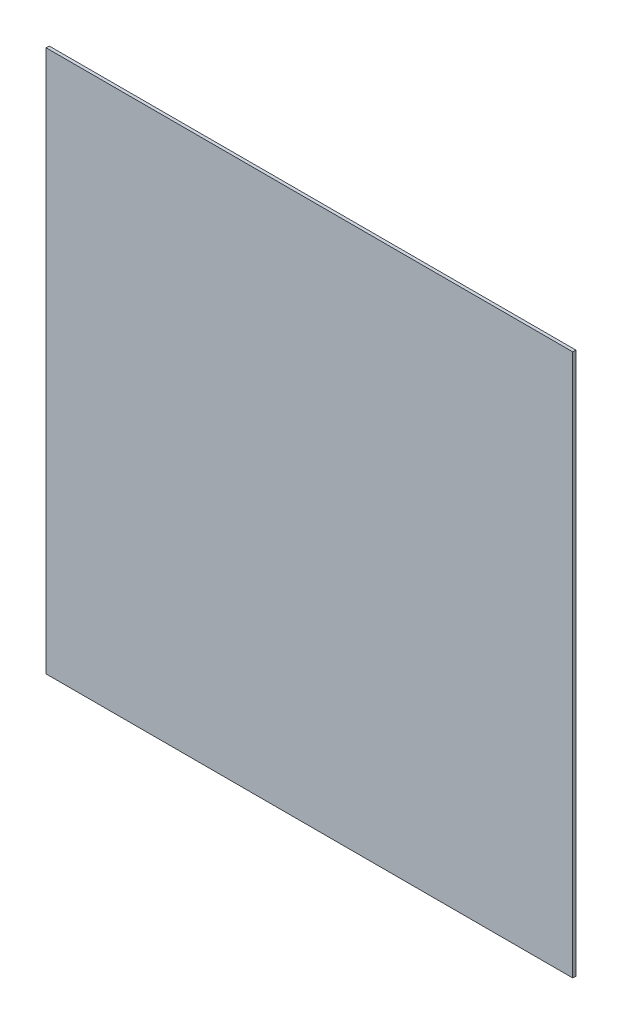
from build123d import *

# Parameters (mm, degrees)
SKICA1_W                = 505
SKICA1_H                = 520
P_IDAT_VYSUNUT_M1_DEPTH = 3


with BuildPart() as part:
    # Skica1 → Přidat vysunutím1 (new body)
    with BuildSketch(Plane.XY):
        Rectangle(SKICA1_W, SKICA1_H)
    extrude(amount=P_IDAT_VYSUNUT_M1_DEPTH)


solid = part.part
